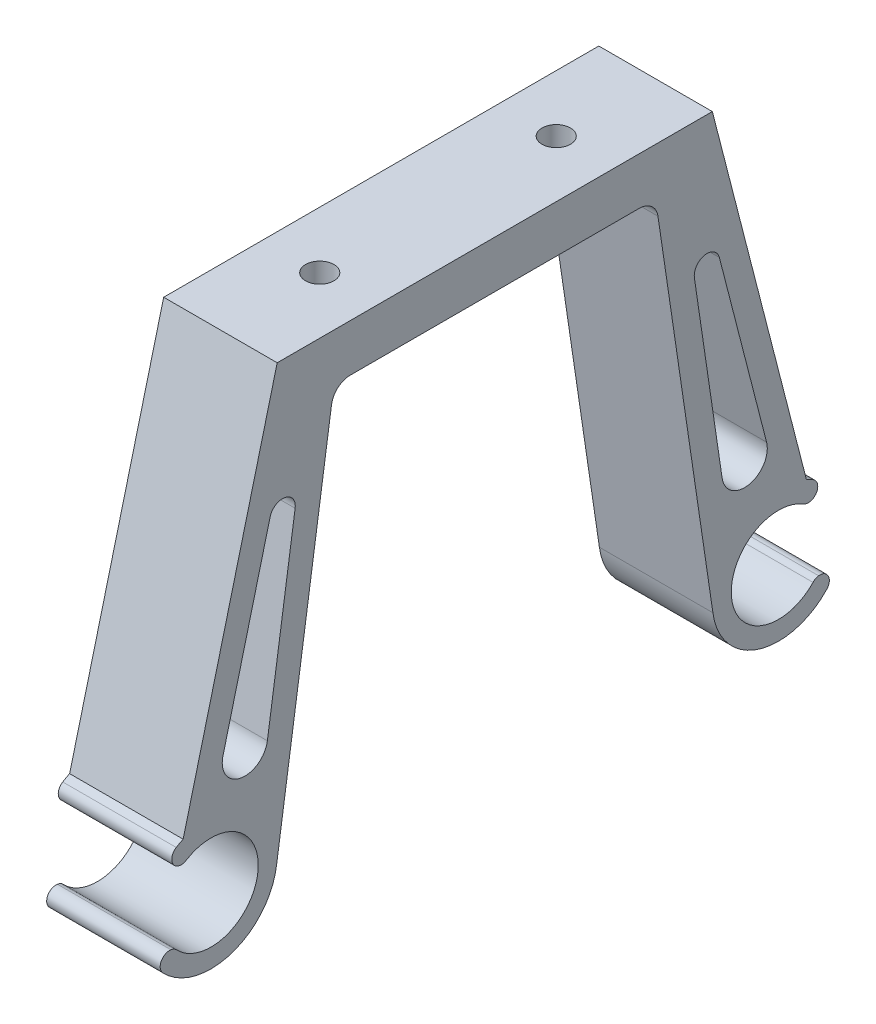
from build123d import *

# Parameters (mm, degrees)
SKETCH1_R           = 7
SKETCH1_R_2         = 5
BOSS_EXTRUDE1_DEPTH = 12
CUT_EXTRUDE1_DEPTH  = 40.522145691
FILLET1_R           = 1
BOSS_EXTRUDE2_START = -12
BOSS_EXTRUDE2_DEPTH = 12
FILLET2_R           = 2
CUT_EXTRUDE2_DEPTH  = 59.481408086
SKETCH7_R           = 1.5
CUT_EXTRUDE3_DEPTH  = 65.024019647


with BuildPart() as part:
    # Sketch1 → Boss-Extrude1 (new body)
    with BuildSketch(Plane(origin=(0, 0, 0), x_dir=(0, 0, -1), z_dir=(1, 0, 0))):
        with Locations((-30, 0)):
            Circle(SKETCH1_R)
        with Locations((-30, 0)):
            Circle(SKETCH1_R_2, mode=Mode.SUBTRACT)
    extrude(amount=BOSS_EXTRUDE1_DEPTH)

    # Sketch3 → Cut-Extrude1 (cut, through all)
    with BuildSketch(Plane(origin=(12, 0, 0), x_dir=(0, 0, -1), z_dir=(1, 0, 0))):
        Polygon((-26.132418273, 3.168881756), (-27.092472621, -4.067712446), (-40.54775296, -2.282646151), (-39.587698612, 4.953948051), align=None)
    extrude(amount=-CUT_EXTRUDE1_DEPTH, mode=Mode.SUBTRACT)

    # Fillet1
    fillet1_edges = [part.edges().sort_by_distance(p)[0] for p in [
        (6, 4.067712446, 32.907527379),
        (6, 4.403840469, 35.441156966),
        (6, -3.168881756, 33.867581727),
        (6, -2.832753733, 36.401211314),
    ]]
    fillet(fillet1_edges, radius=FILLET1_R - 0.0001)  # a hair under: the kernel refuses the full size

    # Sketch4 → Boss-Extrude2 (add)
    with BuildSketch(Plane(origin=(12, 0, 0), x_dir=(0, 0, -1), z_dir=(1, 0, 0)).offset(BOSS_EXTRUDE2_START)):
        with BuildLine():
            Line((-23.06080008, -0.92060006), (-17, 40))
            Line((-17, 40), (0, 40))
            Line((0, 40), (0, 45))
            Line((0, 45), (-23, 45))
            Line((-23, 45), (-32.940967226, 6.352221011))
            ThreePointArc((-32.940967226, 6.352221011), (-25.850307511, 5.63737991), (-23.06080008, -0.92060006))
        make_face()
    extrude(amount=BOSS_EXTRUDE2_DEPTH)

    # Fillet2
    fillet2_edges = [part.edges().sort_by_distance(p)[0] for p in [
        (6, 40, 17),
    ]]
    fillet(fillet2_edges, radius=FILLET2_R)

    # Sketch6 → Cut-Extrude2 (cut, through all)
    with BuildSketch(Plane(origin=(12, 0, 0), x_dir=(0, 0, -1), z_dir=(1, 0, 0))):
        with BuildLine():
            Line((-24.037943225, 10.910448491), (-21.102528553, 30.729437441))
            ThreePointArc((-21.102528553, 30.729437441), (-22.170547869, 32.250479964), (-23.74540162, 31.263529469))
            Line((-23.74540162, 31.263529469), (-28.73638424, 11.859945407))
            ThreePointArc((-28.73638424, 11.859945407), (-26.887444194, 8.909635204), (-24.037943225, 10.910448491))
        make_face()
    extrude(amount=-CUT_EXTRUDE2_DEPTH, mode=Mode.SUBTRACT)

    # Mirror9: part across plane


with BuildPart() as part_1:
    add(part.part)
    add(part.part.mirror(Plane(origin=(-56.513793287, 40, 0), x_dir=(1, 0, 0), z_dir=(0, 0, -1))))

    # Sketch7 → Cut-Extrude3 (cut, through all)
    with BuildSketch(Plane(origin=(0, 45, 0), x_dir=(1, 0, 0), z_dir=(0, 1, 0))):
        with Locations(Location((6, -12.5, 0), (0, 0, 270))):
            Circle(SKETCH7_R)
        with Locations(Location((6, 12.5, 0), (0, 0, 270))):
            Circle(SKETCH7_R)
    extrude(amount=-CUT_EXTRUDE3_DEPTH, mode=Mode.SUBTRACT)


solid = part_1.part
